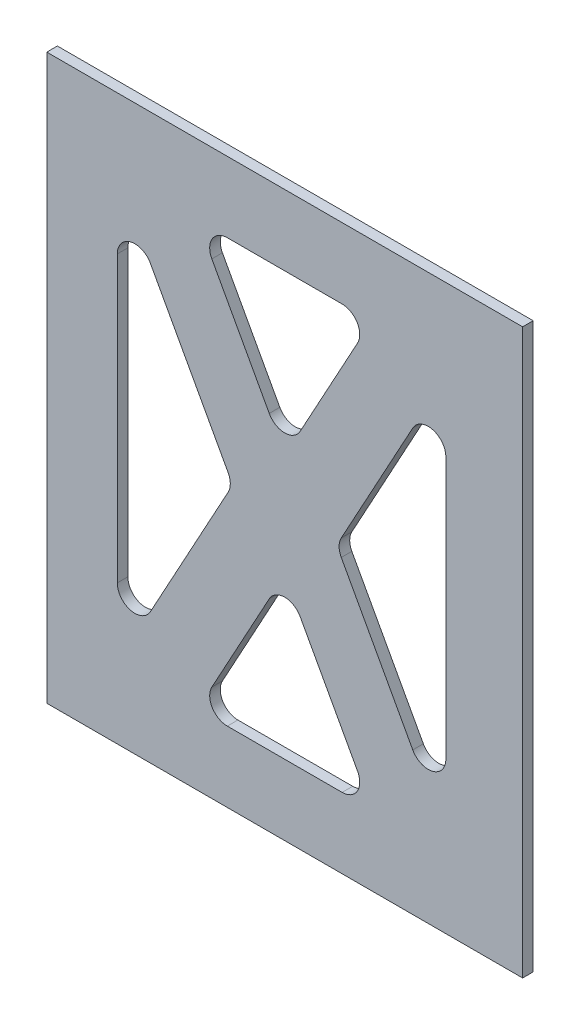
from build123d import *

# Parameters (mm, degrees)
SKETCH1_W           = 135
SKETCH1_H           = 160
BOSS_EXTRUDE1_DEPTH = 3


with BuildPart() as part:
    # Sketch1 → Boss-Extrude1 (new body)
    with BuildSketch(Plane.XY.offset(152)):
        Rectangle(SKETCH1_W, SKETCH1_H)
        with BuildLine():
            Line((-47.5, -40.409274017), (-47.5, 40.409274017))
            ThreePointArc((-47.5, 40.409274017), (-43.73647802, 45.253974432), (-38.111551158, 42.805420247))
            Line((-38.111551158, 42.805420247), (-16.047598021, 2.39614623))
            ThreePointArc((-16.047598021, 2.39614623), (-15.436046863, 0), (-16.047598021, -2.39614623))
            Line((-16.047598021, -2.39614623), (-38.111551158, -42.805420247))
            ThreePointArc((-38.111551158, -42.805420247), (-43.73647802, -45.253974432), (-47.5, -40.409274017))
        make_face(mode=Mode.SUBTRACT)
        with BuildLine():
            Line((16.286070872, 60), (-16.286070872, 60))
            ThreePointArc((-16.286070872, 60), (-20.586113381, 57.551398523), (-20.674519714, 52.60385377))
            Line((-20.674519714, 52.60385377), (-4.388448842, 22.77654692))
            ThreePointArc((-4.388448842, 22.77654692), (0, 20.172693151), (4.388448842, 22.77654692))
            Line((4.388448842, 22.77654692), (20.674519714, 52.60385377))
            ThreePointArc((20.674519714, 52.60385377), (20.586113381, 57.551398523), (16.286070872, 60))
        make_face(mode=Mode.SUBTRACT)
        with BuildLine():
            Line((36.328559522, 39.539940252), (16.047598021, 2.39614623))
            ThreePointArc((16.047598021, 2.39614623), (15.436046863, 0), (16.047598021, -2.39614623))
            Line((16.047598021, -2.39614623), (36.328559522, -39.539940252))
            ThreePointArc((36.328559522, -39.539940252), (41.953486384, -41.988494437), (45.717008364, -37.143794022))
            Line((45.717008364, -37.143794022), (45.717008364, 37.143794022))
            ThreePointArc((45.717008364, 37.143794022), (41.953486384, 41.988494437), (36.328559522, 39.539940252))
        make_face(mode=Mode.SUBTRACT)
        with BuildLine():
            Line((-20.674519714, -52.60385377), (-4.388448842, -22.77654692))
            ThreePointArc((-4.388448842, -22.77654692), (0, -20.172693151), (4.388448842, -22.77654692))
            Line((4.388448842, -22.77654692), (20.674519714, -52.60385377))
            ThreePointArc((20.674519714, -52.60385377), (20.586113381, -57.551398523), (16.286070872, -60))
            Line((16.286070872, -60), (-16.286070872, -60))
            ThreePointArc((-16.286070872, -60), (-20.586113381, -57.551398523), (-20.674519714, -52.60385377))
        make_face(mode=Mode.SUBTRACT)
    extrude(amount=BOSS_EXTRUDE1_DEPTH)


solid = part.part
